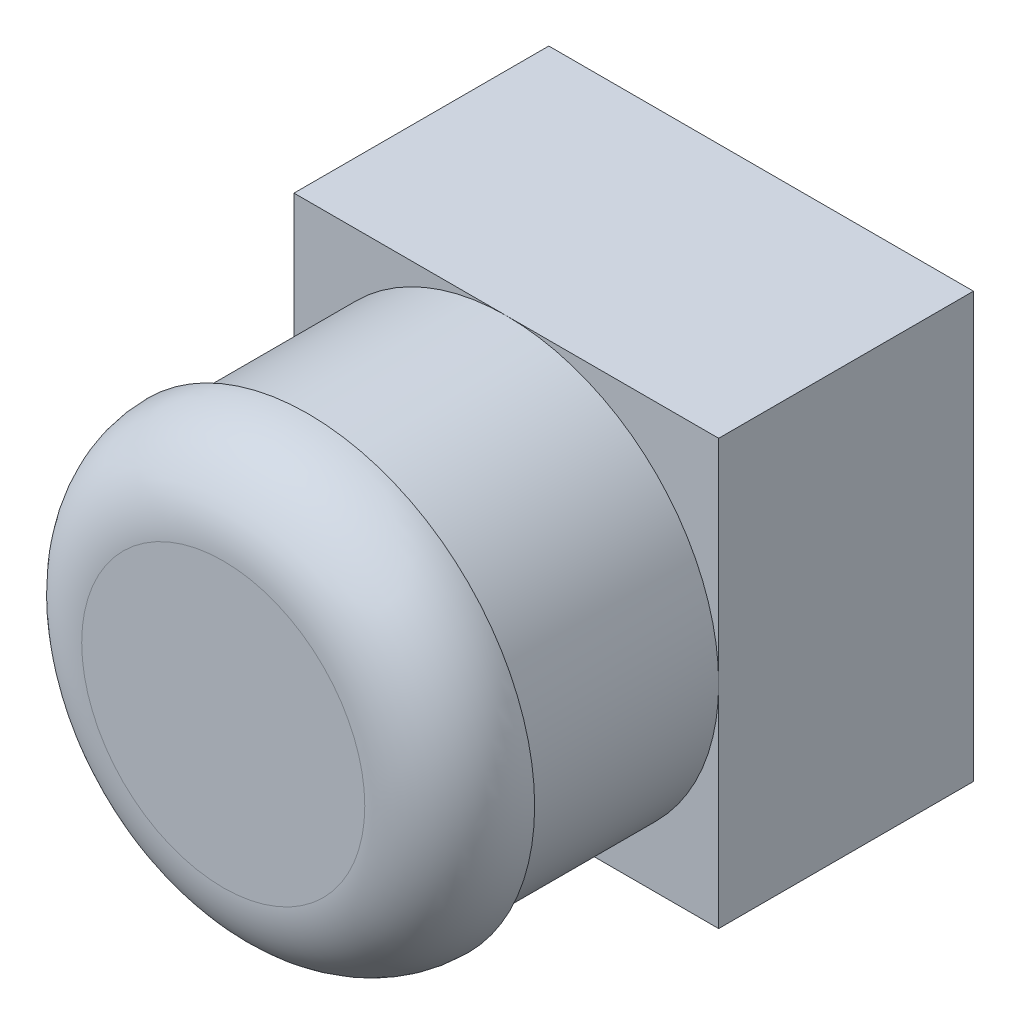
from build123d import *

# Parameters (mm, degrees)
SKETCH_1_W      = 15
SKETCH_1_H      = 15
EXTRUDE_1_DEPTH = 9
SKETCH_5_R      = 7.5
EXTRUDE_2_DEPTH = 7
SKETCH_6_R      = 8
EXTRUDE_3_DEPTH = 3
FILLET_1_R      = 3


with BuildPart() as part:
    # 草图1 → 凸台-拉伸1 (new body)
    with BuildSketch(Plane.XY):
        Rectangle(SKETCH_1_W, SKETCH_1_H)
    extrude(amount=EXTRUDE_1_DEPTH)

    # 草图5 → 凸台-拉伸2 (add)
    with BuildSketch(Plane.XY.offset(9)):
        Circle(SKETCH_5_R)
    extrude(amount=EXTRUDE_2_DEPTH)

    # 草图6 → 凸台-拉伸3 (add)
    with BuildSketch(Plane.XY.offset(16)):
        Circle(SKETCH_6_R)
    extrude(amount=EXTRUDE_3_DEPTH)

    # 圆角1
    fillet_1_edges = [part.edges().sort_by_distance(p)[0] for p in [
        (-8, 0, 19),
    ]]
    fillet(fillet_1_edges, radius=FILLET_1_R - 0.0001)  # a hair under: the kernel refuses the full size


solid = part.part
